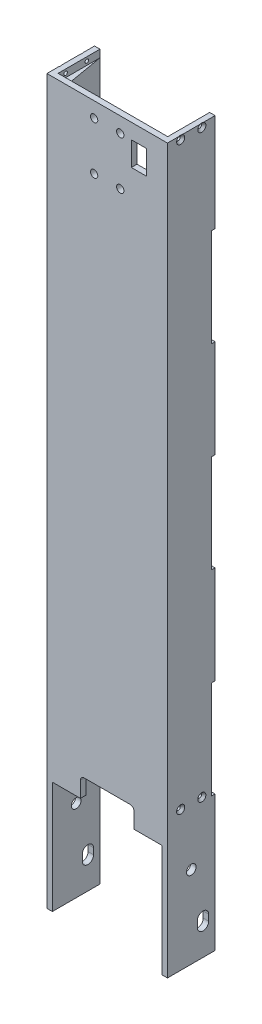
from build123d import *

# Parameters (mm, degrees)
BOSS_EXTRUDE1_DEPTH = 609.6
SKETCH5_W           = 92.456
SKETCH5_H           = 40.132
CUT_EXTRUDE4_DEPTH  = 94.488
SKETCH6_R           = 3.0734
SKETCH6_W           = 45.116342256
SKETCH6_H           = 16.485642943
SKETCH6_W_2         = 12.7
SKETCH6_H_2         = 20.2565
CUT_EXTRUDE5_DEPTH  = 620.310340156
SKETCH4_R           = 4.064
SKETCH4_W           = 3.175
SKETCH4_H           = 82.55
SKETCH4_R_2         = 1.524
CUT_EXTRUDE3_DEPTH  = 620.310340156
SKETCH7_W           = 92.456
SKETCH7_H           = 35.3314
CUT_EXTRUDE6_DEPTH  = 6.35
SKETCH8_W           = 92.456
SKETCH8_H           = 35.3314
CUT_EXTRUDE7_DEPTH  = 26.162
SKETCH10_R          = 1.1303
CUT_EXTRUDE8_DEPTH  = 12.7
CHAMFER1_SIZE       = 1.905
FILLET1_R           = 3.175


with BuildPart() as part:
    # Sketch1 → Boss-Extrude1 (new body)
    with BuildSketch(Plane(origin=(0, 0, 0), x_dir=(1, 0, 0), z_dir=(0, 1, 0))):
        with BuildLine():
            Line((0, 0), (0, 40.132))
            Line((0, 40.132), (2.032, 40.132))
            Line((2.032, 40.132), (4.572, 40.132))
            Line((4.572, 40.132), (9.758667803, 10.070937859))
            ThreePointArc((9.758667803, 10.070937859), (11.925571203, 6.293730916), (16.016209625, 4.8006))
            Line((16.016209625, 4.8006), (85.583790375, 4.8006))
            ThreePointArc((85.583790375, 4.8006), (89.674428797, 6.293730916), (91.841332197, 10.070937859))
            Line((91.841332197, 10.070937859), (97.028, 40.132))
            Line((97.028, 40.132), (99.568, 40.132))
            Line((99.568, 40.132), (101.6, 40.132))
            Line((101.6, 40.132), (101.6, 0))
            Line((101.6, 0), (0, 0))
        make_face()
    extrude(amount=BOSS_EXTRUDE1_DEPTH)

    # Sketch5 → Cut-Extrude4 (cut)
    with BuildSketch(Plane.XZ):
        with Locations((50.8, -20.066)):
            Rectangle(SKETCH5_W, SKETCH5_H)
    extrude(amount=-CUT_EXTRUDE4_DEPTH, mode=Mode.SUBTRACT)

    # Sketch6 → Cut-Extrude5 (cut, through all)
    with BuildSketch(Plane.XY):
        with Locations((39.7891, 596.796653012)):
            Circle(SKETCH6_R)
        with Locations((39.7891, 556.283653012)):
            Circle(SKETCH6_R)
        with Locations((61.8109, 556.283653012)):
            Circle(SKETCH6_R)
        with Locations((61.8109, 596.796653012)):
            Circle(SKETCH6_R)
        with Locations((50.8, 102.730821472)):
            Rectangle(SKETCH6_W, SKETCH6_H)
        with Locations((77.5081, 586.668403012)):
            Rectangle(SKETCH6_W_2, SKETCH6_H_2)
    extrude(amount=-CUT_EXTRUDE5_DEPTH, mode=Mode.SUBTRACT)

    # Sketch4 → Cut-Extrude3 (cut, through all)
    with BuildSketch(Plane.ZY):
        with BuildLine():
            Line((-25.208591254, 24.104081866), (-25.208591254, 29.184081866))
            ThreePointArc((-25.208591254, 29.184081866), (-29.971091254, 33.946581866), (-34.733591254, 29.184081866))
            Line((-34.733591254, 29.184081866), (-34.733591254, 24.104081866))
            ThreePointArc((-34.733591254, 24.104081866), (-29.971091254, 19.341581866), (-25.208591254, 24.104081866))
        make_face()
        with Locations((-20.066, 69.088)):
            Circle(SKETCH4_R)
        with Locations((-38.5445, 155.575)):
            Rectangle(SKETCH4_W, SKETCH4_H)
        with Locations((-38.5445, 320.675)):
            Rectangle(SKETCH4_W, SKETCH4_H)
        with Locations((-38.5445, 485.775)):
            Rectangle(SKETCH4_W, SKETCH4_H)
        with Locations(Location((-28.9814, 117.475, 0), (0, 0, 180))):
            Circle(SKETCH4_R_2)
        with Locations((-11.1506, 117.475)):
            Circle(SKETCH4_R_2)
        with Locations(Location((-11.1506, 606.425, 0), (0, 0, 315.108108431))):
            Circle(SKETCH4_R_2)
        with Locations((-28.9814, 606.425)):
            Circle(SKETCH4_R_2)
    extrude(amount=-CUT_EXTRUDE3_DEPTH, mode=Mode.SUBTRACT)

    # Sketch7 → Cut-Extrude6 (cut)
    with BuildSketch(Plane(origin=(0, 609.6, 0), x_dir=(1, 0, 0), z_dir=(0, 1, 0))):
        with Locations((50.8, 22.4663)):
            Rectangle(SKETCH7_W, SKETCH7_H)
    extrude(amount=-CUT_EXTRUDE6_DEPTH, mode=Mode.SUBTRACT)

    # Sketch8 → Cut-Extrude7 (cut)
    with BuildSketch(Plane.XZ.offset(-94.488)):
        with Locations((50.8, -22.4663)):
            Rectangle(SKETCH8_W, SKETCH8_H)
    extrude(amount=-CUT_EXTRUDE7_DEPTH, mode=Mode.SUBTRACT)

    # Sketch10 → Cut-Extrude8 (cut)
    with BuildSketch(Plane(origin=(0, 0, -36.957), x_dir=(-1, 0, 0), z_dir=(0, 0, -1))):
        with Locations((-2.286, 155.321)):
            Circle(SKETCH10_R)
        with Locations((-2.286, 320.421)):
            Circle(SKETCH10_R)
        with Locations((-2.286, 485.64141222)):
            Circle(SKETCH10_R)
        with Locations((-99.314, 155.321)):
            Circle(SKETCH10_R)
        with Locations((-99.314, 320.421)):
            Circle(SKETCH10_R)
        with Locations((-99.314, 485.64141222)):
            Circle(SKETCH10_R)
    extrude(amount=-CUT_EXTRUDE8_DEPTH, mode=Mode.SUBTRACT)

    # Chamfer1
    # the kernel refuses this chamfer: 1.905 mm, written as the material it takes off along each edge
    with BuildSketch(Plane(origin=(0, 117.475, -28.9814), x_dir=(0, 0, -1), z_dir=(0, 1, 0))) as chamfer1_piece_1:
        Polygon((1.524, -CHAMFER1_SIZE), (1.524 + CHAMFER1_SIZE, 0), (1.524, 0), align=None)
    revolve(axis=Axis((0, 117.475, -28.9814), (-1, 0, 0)), mode=Mode.SUBTRACT)
    with BuildSketch(Plane(origin=(101.6, 117.475, -28.9814), x_dir=(0, 0, -1), z_dir=(0, 1, 0))) as chamfer1_piece_2:
        Polygon((1.524, CHAMFER1_SIZE), (1.524 + CHAMFER1_SIZE, 0), (1.524, 0), align=None)
    revolve(axis=Axis((101.6, 117.475, -28.9814), (-1, 0, 0)), mode=Mode.SUBTRACT)
    with BuildSketch(Plane(origin=(101.6, 117.475, -11.1506), x_dir=(0, 0, 1), z_dir=(0, -1, 0))) as chamfer1_piece_3:
        Polygon((1.524, CHAMFER1_SIZE), (1.524 + CHAMFER1_SIZE, 0), (1.524, 0), align=None)
    revolve(axis=Axis((101.6, 117.475, -11.1506), (-1, 0, 0)), mode=Mode.SUBTRACT)
    with BuildSketch(Plane(origin=(0, 117.475, -11.1506), x_dir=(0, 0, 1), z_dir=(0, -1, 0))) as chamfer1_piece_4:
        Polygon((1.524, -CHAMFER1_SIZE), (1.524 + CHAMFER1_SIZE, 0), (1.524, 0), align=None)
    revolve(axis=Axis((0, 117.475, -11.1506), (-1, 0, 0)), mode=Mode.SUBTRACT)
    with BuildSketch(Plane(origin=(0, 606.425, -11.1506), x_dir=(0, -0.7057713201939051, 0.7084397247414577), z_dir=(0, -0.7084397247414577, -0.7057713201939051))) as chamfer1_piece_5:
        Polygon((1.524, -CHAMFER1_SIZE), (1.524 + CHAMFER1_SIZE, 0), (1.524, 0), align=None)
    revolve(axis=Axis((0, 606.425, -11.1506), (-1, 0, 0)), mode=Mode.SUBTRACT)
    with BuildSketch(Plane(origin=(101.6, 606.425, -11.1506), x_dir=(0, -0.7057713201939051, 0.7084397247414577), z_dir=(0, -0.7084397247414577, -0.7057713201939051))) as chamfer1_piece_6:
        Polygon((1.524 + CHAMFER1_SIZE, 0), (1.524, CHAMFER1_SIZE), (1.524, 0), align=None)
    revolve(axis=Axis((101.6, 606.425, -11.1506), (-1, 0, 0)), mode=Mode.SUBTRACT)
    with BuildSketch(Plane(origin=(101.6, 606.425, -28.9814), x_dir=(0, 0, 1), z_dir=(0, -1, 0))) as chamfer1_piece_7:
        Polygon((1.524 + CHAMFER1_SIZE, 0), (1.524, CHAMFER1_SIZE), (1.524, 0), align=None)
    revolve(axis=Axis((101.6, 606.425, -28.9814), (-1, 0, 0)), mode=Mode.SUBTRACT)
    with BuildSketch(Plane(origin=(0, 606.425, -28.9814), x_dir=(0, 0, 1), z_dir=(0, -1, 0))) as chamfer1_piece_8:
        Polygon((1.524, -CHAMFER1_SIZE), (1.524 + CHAMFER1_SIZE, 0), (1.524, 0), align=None)
    revolve(axis=Axis((0, 606.425, -28.9814), (-1, 0, 0)), mode=Mode.SUBTRACT)

    # Fillet1
    fillet1_edges = [part.edges().sort_by_distance(p)[0] for p in [
        (28.241828872, 110.973642943, -2.4003),
        (73.358171128, 110.973642943, -2.4003),
    ]]
    fillet(fillet1_edges, radius=FILLET1_R)


solid = part.part
